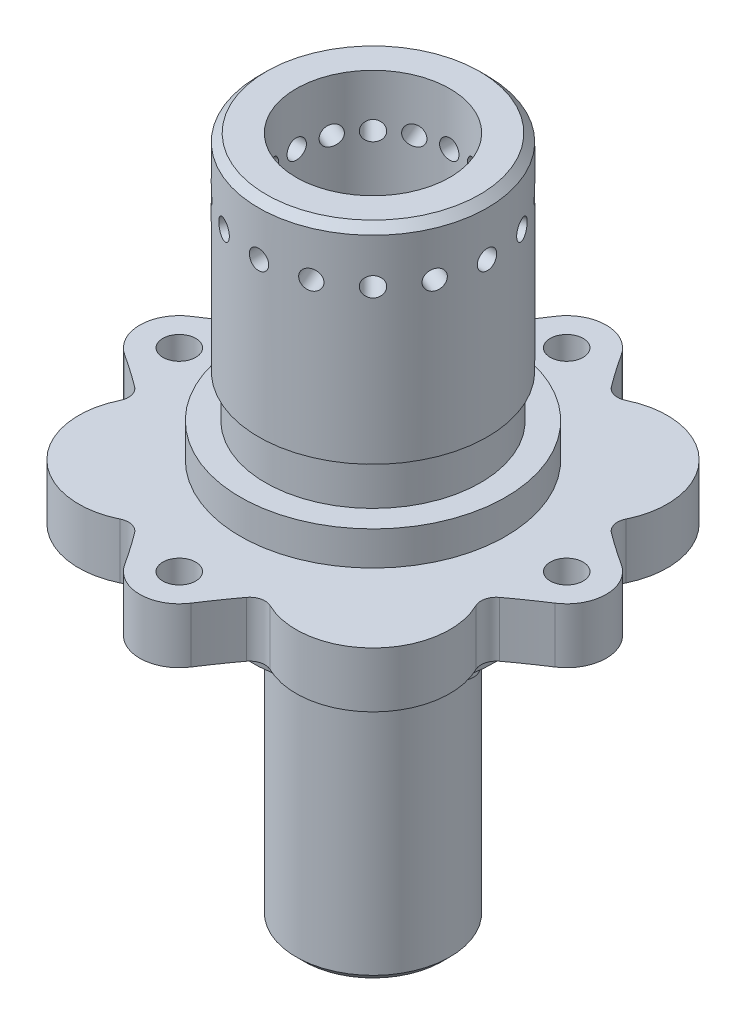
from build123d import *

# Parameters (mm, degrees)
SKETCH5_W                     = 15.875
SKETCH5_H                     = 79.375
DRIVE_PIN_HOLES_D             = 6.8
DRIVE_PIN_HOLES_PATTERN_COUNT = 4
FLANGE_SUPPORT_CUT_REACH      = 104.834
SKETCH8_R                     = 52.5
SKETCH10_R                    = 25.0825
BRAKE_HAT_HEX_DEPTH           = 4.7625
F_5_16_CLEARANCE_HOLE1_D      = 8.2042
SKETCH14_R                    = 2
PIN_HOLES_DEPTH               = 99.496921864
PIN_HOLE_PATTERN_COUNT        = 16
FILLET1_R                     = 3.175
FILLET2_R                     = 3.175


with BuildPart() as part:
    # Sketch1 → Bearing Shaft/Flange Support (revolve)
    with BuildSketch(Plane(origin=(0, 0, 0), x_dir=(0, 0, -1), z_dir=(1, 0, 0))):
        Polygon((0, 0), (-27.254672075, 0), (-25.0825, -12.319), (-25.0825, -17.0815), (-15.875, -17.0815), (-15.875, -69.56298), (-14.2875, -71.15048), (0, -71.15048), align=None)
    revolve(axis=Axis((0, 0, 0), (0, 1, 0)))

    # Sketch2 → Drive Pin Support (revolve)
    with BuildSketch(Plane(origin=(0, 0, 0), x_dir=(0, 0, -1), z_dir=(1, 0, 0))):
        Polygon((0, 0), (-52.5, 0), (-52.5, 11.43), (-27.4096, 11.43), (-27.4096, 18.43), (-22.225, 18.43), (-22.225, 27.305), (-23.61946, 27.305), (-23.61946, 68.2625), (-22.03196, 69.85), (0, 69.85), align=None)
    revolve(axis=Axis((0, 0, 0), (0, 1, 0)))

    # Sketch5 → Center Mass Removal (revolve, cut)
    with BuildSketch(Plane(origin=(0, 0, 0), x_dir=(0, 0, -1), z_dir=(1, 0, 0))):
        with Locations((7.9375, 30.1625)):
            Rectangle(SKETCH5_W, SKETCH5_H)
    revolve(axis=Axis((0, 0, 0), (0, -1, 0)), mode=Mode.SUBTRACT)

    # Drive Pin Holes (through all)
    with Locations(Plane(origin=(0, 0, 0), x_dir=(-1, 0, 0), z_dir=(0, -1, 0))):
        with Locations((0, -40)):
            drive_pin_holes = Hole(DRIVE_PIN_HOLES_D / 2)

    # Drive Pin Holes Pattern: Drive Pin Holes ×4 about axis
    drive_pin_holes_pattern_axis = Axis((0, 0, 0), (0, -1, 0))
    for i in range(1, DRIVE_PIN_HOLES_PATTERN_COUNT):
        add(drive_pin_holes.rotate(drive_pin_holes_pattern_axis, i * 360 / DRIVE_PIN_HOLES_PATTERN_COUNT), mode=Mode.SUBTRACT)

    # Sketch8 → Flange Support Cut (cut, up to next)
    with BuildSketch(Plane.XZ, mode=Mode.PRIVATE) as flange_support_cut_sk1:
        Circle(SKETCH8_R)
        with BuildLine():
            ThreePointArc((-6.851776468, 44.436165629), (0, 48.1625), (6.851776468, 44.436165629))
            ThreePointArc((6.851776468, 44.436165629), (9.964767607, 39.850591878), (13.274865482, 35.405206349))
            ThreePointArc((13.274865482, 35.405206349), (33.675960454, 33.675960454), (35.405206349, 13.274865482))
            ThreePointArc((35.405206349, 13.274865482), (39.850591878, 9.964767607), (44.436165629, 6.851776468))
            ThreePointArc((44.436165629, 6.851776468), (48.1625, 0), (44.436165629, -6.851776468))
            ThreePointArc((44.436165629, -6.851776468), (39.850591878, -9.964767607), (35.405206349, -13.274865482))
            ThreePointArc((35.405206349, -13.274865482), (33.675960454, -33.675960454), (13.274865482, -35.405206349))
            ThreePointArc((13.274865482, -35.405206349), (9.964767607, -39.850591878), (6.851776468, -44.436165629))
            ThreePointArc((6.851776468, -44.436165629), (0, -48.1625), (-6.851776468, -44.436165629))
            ThreePointArc((-6.851776468, -44.436165629), (-9.964767607, -39.850591878), (-13.274865482, -35.405206349))
            ThreePointArc((-13.274865482, -35.405206349), (-33.675960454, -33.675960454), (-35.405206349, -13.274865482))
            ThreePointArc((-35.405206349, -13.274865482), (-39.850591878, -9.964767607), (-44.436165629, -6.851776468))
            ThreePointArc((-44.436165629, -6.851776468), (-48.1625, 0), (-44.436165629, 6.851776468))
            ThreePointArc((-44.436165629, 6.851776468), (-39.850591878, 9.964767607), (-35.405206349, 13.274865482))
            ThreePointArc((-35.405206349, 13.274865482), (-33.675960454, 33.675960454), (-13.274865482, 35.405206349))
            ThreePointArc((-13.274865482, 35.405206349), (-9.964767607, 39.850591878), (-6.851776468, 44.436165629))
        make_face(mode=Mode.SUBTRACT)
    flange_support_cut_tool1 = extrude(flange_support_cut_sk1.sketch, amount=-FLANGE_SUPPORT_CUT_REACH, mode=Mode.PRIVATE) & part.part
    add(flange_support_cut_tool1.solids().sort_by_distance((-51.015076, 0, 0))[0], mode=Mode.SUBTRACT)

    # Sketch10 → Brake Hat Hex (cut)
    with BuildSketch(Plane.XZ.offset(17.0815)):
        Circle(SKETCH10_R)
        Polygon((10.631905207, -18.415), (21.263810414, 0), (10.631905207, 18.415), (-10.631905207, 18.415), (-21.263810414, 0), (-10.631905207, -18.415), align=None, mode=Mode.SUBTRACT)
    extrude(amount=-BRAKE_HAT_HEX_DEPTH, mode=Mode.SUBTRACT)

    # 5/16 Clearance Hole1 (through all)
    with Locations(Plane(origin=(0, -71.15048, 0), x_dir=(-1, 0, 0), z_dir=(0, -1, 0))):
        with Locations((0, 0)):
            Hole(F_5_16_CLEARANCE_HOLE1_D / 2)

    # Sketch14 → Pin Holes (cut, through all)
    with BuildSketch(Plane(origin=(0, 0, 0), x_dir=(0, 0, -1), z_dir=(1, 0, 0))):
        with Locations((0, 59.05)):
            Circle(SKETCH14_R)
    pin_holes = extrude(amount=-PIN_HOLES_DEPTH, mode=Mode.SUBTRACT)

    # Pin Hole Pattern: Pin Holes ×16 about axis
    pin_hole_pattern_axis = Axis((0, 0, 0), (0, -1, 0))
    for i in range(1, PIN_HOLE_PATTERN_COUNT):
        add(pin_holes.rotate(pin_hole_pattern_axis, i * 360 / PIN_HOLE_PATTERN_COUNT), mode=Mode.SUBTRACT)

    # Fillet1
    fillet1_edges = [part.edges().sort_by_distance(p)[0] for p in [
        (-13.274865482, 5.715, 35.405206349),
        (-35.405206349, 5.715, 13.274865482),
        (-35.405206349, 5.715, -13.274865482),
        (-13.274865482, 5.715, -35.405206349),
        (13.274865482, 5.715, -35.405206349),
        (35.405206349, 5.715, -13.274865482),
        (35.405206349, 5.715, 13.274865482),
        (13.274865482, 5.715, 35.405206349),
    ]]
    fillet(fillet1_edges, radius=FILLET1_R)

    # Fillet2
    fillet2_edges = [part.edges().sort_by_distance(p)[0] for p in [
        (-21.263810414, -14.70025, 0),
        (-10.631905207, -14.70025, -18.415),
        (10.631905207, -14.70025, -18.415),
        (21.263810414, -14.70025, 0),
        (10.631905207, -14.70025, 18.415),
        (-10.631905207, -14.70025, 18.415),
    ]]
    fillet(fillet2_edges, radius=FILLET2_R)


solid = part.part
